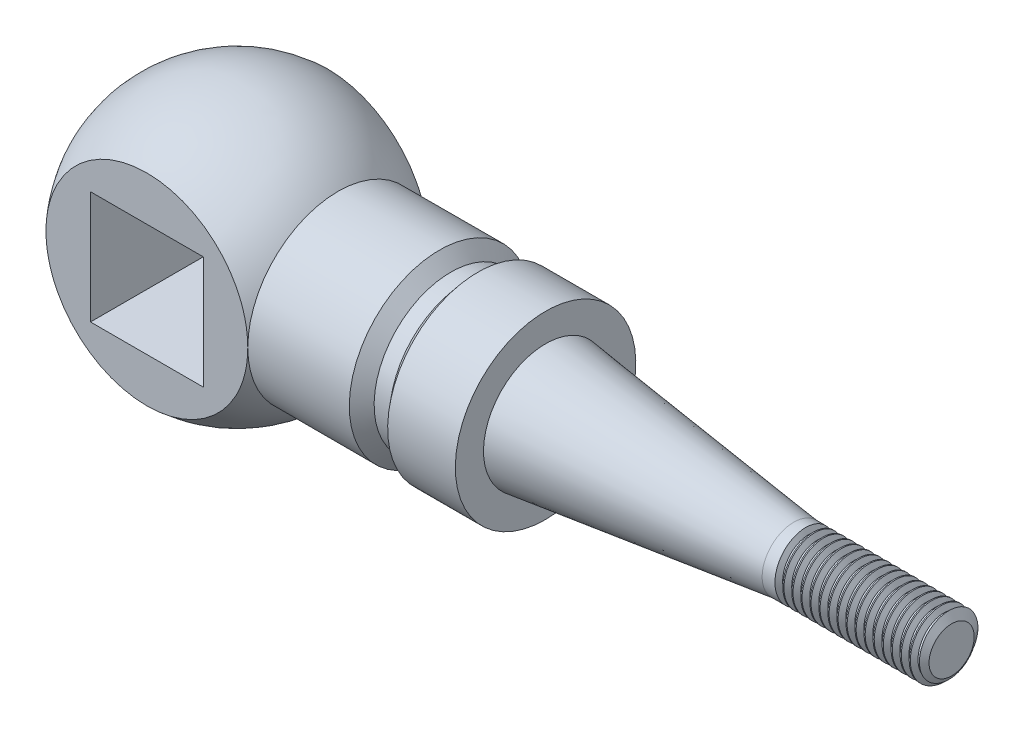
from build123d import *

# Parameters (mm, degrees)
SKETCH2_W          = 80.57331593
SKETCH2_H          = 21.312941633
SKETCH2_W_2        = 101.366429719
SKETCH2_H_2        = 25.4
CUT_EXTRUDE1_DEPTH = 163.740213408
THREAD1_PITCH      = 2.54
SKETCH10_W         = 31.75
SKETCH10_H         = 31.75
CUT_EXTRUDE2_DEPTH = 153.507629514


with BuildPart() as part:
    # Sketch1 → Revolve1 (revolve)
    with BuildSketch(Plane.XY, mode=Mode.PRIVATE) as revolve1_sk:
        with BuildLine():
            Line((-100.559031657, 0), (100.559031657, 0))
            Line((100.559031657, 0), (100.559031657, 8.89))
            Line((100.559031657, 8.89), (56.109031657, 8.89))
            Line((56.109031657, 8.89), (-13.740968343, 17.466501579))
            Line((-13.740968343, 17.466501579), (-13.740968343, 25.4))
            Line((-13.740968343, 25.4), (-32.790968343, 25.4))
            Line((-32.790968343, 25.4), (-35.965968343, 21.59))
            Line((-35.965968343, 21.59), (-40.410968343, 21.59))
            Line((-40.410968343, 21.59), (-43.585968343, 25.4))
            Line((-43.585968343, 25.4), (-72.160968343, 25.4))
            ThreePointArc((-72.160968343, 25.4), (-114.153953277, 35.591966876), (-138.659031657, 0))
            Line((-138.659031657, 0), (-100.559031657, 0))
        make_face()
    revolve(revolve1_sk.sketch.rotate(Axis((-100.559031657, 0, 0), (1, 0, 0)), 180), axis=Axis((-100.559031657, 0, 0), (1, 0, 0)))

    # Sketch2 → Cut-Extrude1 (cut, through all)
    with BuildSketch(Plane(origin=(0, 38.1, 0), x_dir=(1, 0, 0), z_dir=(0, 1, 0))):
        with Locations((-106.280571541, -36.056470817)):
            Rectangle(SKETCH2_W, SKETCH2_H)
        with Locations((-100.302551327, 38.1)):
            Rectangle(SKETCH2_W_2, SKETCH2_H_2)
    extrude(amount=-CUT_EXTRUDE1_DEPTH, mode=Mode.SUBTRACT)

    # Thread1: arcs per turn and ends read off the stored shape
    # Thread1: the profile of Thread Profile1 profile screwed along a right-hand helix through 16.6 turns, 10 arcs to a turn; built about Z, then put on its axis
    thread1_z = Axis((0, 0, 0), (0, 0, 1))
    thread1_corners = [(8.8903, 0, -0.000173205), (8.8903, 0, 2.222673198), (7.515184677, 0, 1.428749996), (7.515184677, 0, 0.793749996)]
    with BuildLine(mode=Mode.PRIVATE) as thread1_profile:
        Line(thread1_corners[0], thread1_corners[1])
        Line(thread1_corners[1], thread1_corners[2])
        Line(thread1_corners[2], thread1_corners[3])
        Line(thread1_corners[3], thread1_corners[0])
    thread1_cap = Face(thread1_profile.wire())
    thread1_turn_angles = [0, 18, 36, 54, 72, 90, 108, 126, 144, 162, 180, 198, 216, 234, 252, 270, 288, 306, 324, 342, 360]
    thread1_turn_weights = [1, 0.9510565162951535, 1, 0.9510565162951535, 1, 0.9510565162951535, 1, 0.9510565162951535, 1, 0.9510565162951535, 1, 0.9510565162951535, 1, 0.9510565162951535, 1, 0.9510565162951535, 1, 0.9510565162951535, 1, 0.9510565162951535, 1]
    thread1_turn_rails = [Edge.make_bspline([Vector(p[0], p[1], 0).rotate(thread1_z, thread1_turn_angles[k]) / thread1_turn_weights[k] + Vector(0, 0, p[2] + THREAD1_PITCH * thread1_turn_angles[k] / 360) for k in range(21)], [0, 0, 0, 1, 1, 2, 2, 3, 3, 4, 4, 5, 5, 6, 6, 7, 7, 8, 8, 9, 9, 10, 10, 10], 2, thread1_turn_weights) for p in thread1_corners]
    thread1_turn_sides = [Face.make_surface_from_curves(thread1_turn_rails[p[0]], thread1_turn_rails[p[1]]) for p in [(0, 1), (1, 2), (2, 3), (3, 0)]]
    thread1_last_angles = [5760, 5778, 5796, 5814, 5832, 5850, 5868, 5886, 5904, 5922, 5940, 5958, 5976]
    thread1_last_weights = [1, 0.9510565162951535, 1, 0.9510565162951535, 1, 0.9510565162951535, 1, 0.9510565162951535, 1, 0.9510565162951535, 1, 0.9510565162951535, 1]
    thread1_last_rails = [Edge.make_bspline([Vector(p[0], p[1], 0).rotate(thread1_z, thread1_last_angles[k]) / thread1_last_weights[k] + Vector(0, 0, p[2] + THREAD1_PITCH * thread1_last_angles[k] / 360) for k in range(13)], [0, 0, 0, 1, 1, 2, 2, 3, 3, 4, 4, 5, 5, 6, 6, 6], 2, thread1_last_weights) for p in thread1_corners]
    thread1_last_sides = [Face.make_surface_from_curves(thread1_last_rails[p[0]], thread1_last_rails[p[1]]) for p in [(0, 1), (1, 2), (2, 3), (3, 0)]]
    thread1 = Plane(origin=(102.591031657, 0, 0), x_dir=(0, 0, 1), z_dir=(-1, 0, 0)) * Solid(Shell([*[p.moved(Location((0, 0, THREAD1_PITCH * i))) for i in range(16) for p in thread1_turn_sides], *thread1_last_sides, thread1_cap, thread1_cap.rotate(thread1_z, 5976).moved(Location((0, 0, THREAD1_PITCH * 5976 / 360)))]))
    add(thread1, mode=Mode.SUBTRACT)

    # Sketch9 → Cut-Revolve2 (revolve, cut)
    with BuildSketch(Plane(origin=(0, 0, 0), x_dir=(1, 0, 0), z_dir=(0, 1, 0)), mode=Mode.PRIVATE) as cut_revolve2_sk:
        Polygon((100.559031657, -6.35), (103.33335614, -6.35), (103.33335614, -10.189145693), (98.342499858, -10.189145693), align=None)
    revolve(cut_revolve2_sk.sketch.rotate(Axis((100.559031657, 0, 0), (1, 0, 0)), 90), axis=Axis((100.559031657, 0, 0), (1, 0, 0)), mode=Mode.SUBTRACT)

    # Sketch10 → Cut-Extrude2 (cut, through all)
    with BuildSketch(Plane.XY.offset(25.4)):
        with Locations((-100.559031657, 0)):
            Rectangle(SKETCH10_W, SKETCH10_H)
    extrude(amount=-CUT_EXTRUDE2_DEPTH, mode=Mode.SUBTRACT)


solid = part.part
